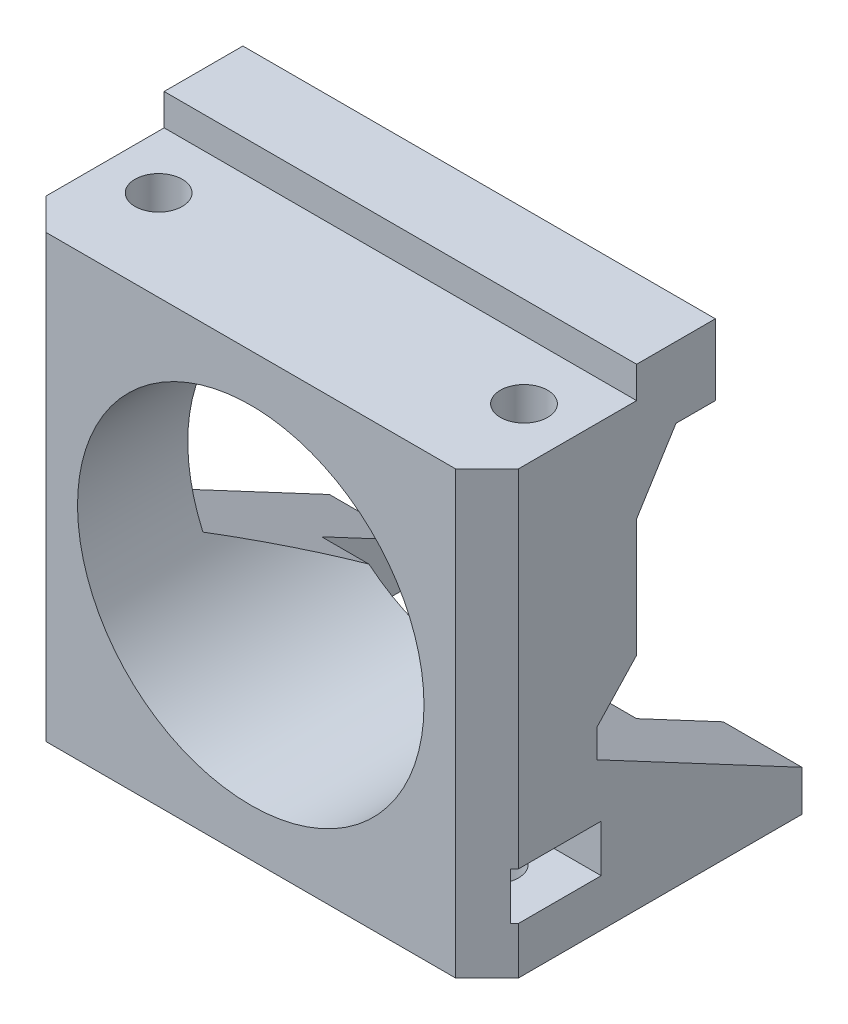
from build123d import *

# Parameters (mm, degrees)
SKETCH1_W                 = 30
SKETCH1_H                 = 28
SKETCH1_R                 = 11
BOSS_EXTRUDE1_DEPTH       = 7
SKETCH2_W                 = 5
SKETCH2_H                 = 2.5
BOSS_EXTRUDE2_DEPTH       = 13
CHAMFER2_SIZE             = 2
BOSS_EXTRUDE6_DEPTH       = 2.5
CHAMFER3_SIZE             = 2
CHAMFER4_SIZE             = 2
BOSS_EXTRUDE4_DEPTH       = 2.5
CHAMFER6_SIZE             = 2.5
CHAMFER7_SIZE             = 7
CHAMFER7_SIZE_2           = 13.165085257
SKETCH7_R                 = 1.5
CUT_EXTRUDE2_DEPTH        = 6.4
BOSS_EXTRUDE7_START       = -2.5
SKETCH8_W                 = 30
SKETCH8_H                 = 5
BOSS_EXTRUDE7_DEPTH       = 4.5
CHAMFER8_SIZE             = 4.000836323
CHAMFER8_SIZE_2           = 2.5
CUT_EXTRUDE3_START        = -3
SKETCH9_R                 = 1.5
CUT_EXTRUDE3_DEPTH        = 3
SKETCH10_W                = 5.5
SKETCH10_H                = 3
CUT_EXTRUDE4_DEPTH        = 5.6
CUT_EXTRUDE5_START        = -30
SKETCH10_2_W              = 5.5
SKETCH10_2_H              = 3
CUT_EXTRUDE5_DEPTH        = 5.6
F_1_0MM_DOWEL_HOLE1_D     = 3
F_1_0MM_DOWEL_HOLE1_DEPTH = 7.098709071
F_1_0MM_DOWEL_HOLE1_TIP   = 0.901290929


with BuildPart() as part:
    # Sketch1 → Boss-Extrude1 (new body)
    with BuildSketch(Plane.XY):
        Rectangle(SKETCH1_W, SKETCH1_H)
        Circle(SKETCH1_R, mode=Mode.SUBTRACT)
    extrude(amount=BOSS_EXTRUDE1_DEPTH)

    # Sketch2 → Boss-Extrude2 (add)
    with BuildSketch(Plane(origin=(0, 0, 0), x_dir=(-1, 0, 0), z_dir=(0, 0, -1))):
        with Locations((-12.5, -12.75)):
            Rectangle(SKETCH2_W, SKETCH2_H)
        with Locations((12.5, -12.75)):
            Rectangle(SKETCH2_W, SKETCH2_H)
    extrude(amount=BOSS_EXTRUDE2_DEPTH)

    # Chamfer2
    chamfer2_edges = [part.edges().sort_by_distance(p)[0] for p in [
        (-10, -12.75, 0),
        (10, -12.75, 0),
    ]]
    chamfer(chamfer2_edges, length=CHAMFER2_SIZE)

    # Sketch5 → Boss-Extrude6 (add)
    with BuildSketch(Plane.XZ.offset(14)):
        Polygon((-10, -2), (-10, -7.5), (10, -7.5), (10, -2), (8, 0), (-8, 0), align=None)
    extrude(amount=-BOSS_EXTRUDE6_DEPTH)

    # Chamfer3
    chamfer3_edges = [part.edges().sort_by_distance(p)[0] for p in [
        (15, 0, 7),
    ]]
    chamfer(chamfer3_edges, length=CHAMFER3_SIZE)

    # Chamfer4
    chamfer4_edges = [part.edges().sort_by_distance(p)[0] for p in [
        (-15, 0, 7),
    ]]
    chamfer(chamfer4_edges, length=CHAMFER4_SIZE)

    # Sketch4 → Boss-Extrude4 (add)
    with BuildSketch(Plane(origin=(0, 0, 0), x_dir=(-1, 0, 0), z_dir=(0, 0, -1))):
        Polygon((-15, 0), (15, 11.5), (15, 14), (-15, 14), align=None)
    extrude(amount=BOSS_EXTRUDE4_DEPTH)

    # Chamfer6
    # the kernel refuses this chamfer: 2.5 mm, written as the material it adds along each edge
    with BuildSketch(Plane(origin=(21.003247512, -2.30124488, 0), x_dir=(-0.3578006820796162, -0.9333930836859554, 0.02749587661058638), z_dir=(-0.9337461173020497, 0.35793601163245237, 0))) as chamfer6_piece_1_section:
        Polygon((CHAMFER6_SIZE * 0.999621916911, -CHAMFER6_SIZE * 0.0274958766106), (-CHAMFER6_SIZE * 0.0274958766106, -CHAMFER6_SIZE * 0.999621916911), (0, 0), align=None)
    chamfer6_piece_1 = extrude(amount=17.263908412, mode=Mode.PRIVATE)
    chamfer6_piece_1 = chamfer6_piece_1 - Plane(origin=(0, 0, -0.835393566), x_dir=(1, 0, 0), z_dir=(0, 0, -1)) * Cylinder(11, 45, mode=Mode.PRIVATE)
    chamfer6_piece_1 = split(chamfer6_piece_1, bisect_by=Plane(origin=(15, -0.113968884, -0.835393566), z_dir=(-1, 0, 0)), keep=Keep.TOP, mode=Mode.PRIVATE)
    add(chamfer6_piece_1)
    with BuildSketch(Plane(origin=(-1.03959441, 6.148511191, 0), x_dir=(-0.35780068207961624, -0.9333930836859554, 0.02749587661058638), z_dir=(-0.9337461173020497, 0.35793601163245237, 0))) as chamfer6_piece_2_section:
        Polygon((CHAMFER6_SIZE * 0.999621916911, -CHAMFER6_SIZE * 0.0274958766106), (-CHAMFER6_SIZE * 0.0274958766106, -CHAMFER6_SIZE * 0.999621916911), (0, 0), align=None)
    chamfer6_piece_2 = extrude(amount=21.380172546, mode=Mode.PRIVATE)
    chamfer6_piece_2 = chamfer6_piece_2 - Plane(origin=(0, 0, -0.851534645), x_dir=(1, 0, 0), z_dir=(0, 0, -1)) * Cylinder(11, 53, mode=Mode.PRIVATE)
    chamfer6_piece_2 = split(chamfer6_piece_2, bisect_by=Plane(origin=(-15, 9.244820467, -0.851534645), z_dir=(1, 0, 0)), keep=Keep.TOP, mode=Mode.PRIVATE)
    add(chamfer6_piece_2)

    # Chamfer7
    # the kernel refuses this chamfer: 13.165085257, 7 mm, written as the material it adds along each edge
    with BuildSketch(Plane(origin=(-15, -11.5, 0), x_dir=(0, 0.9979482451756082, 0.06402577567608186), z_dir=(1, 0, 0))) as chamfer7_piece_1_section:
        Polygon((CHAMFER7_SIZE * 0.997948245176, -CHAMFER7_SIZE * 0.0640257756761), (-CHAMFER7_SIZE_2 * 0.0640257756781, -CHAMFER7_SIZE_2 * 0.997948245208), (0, 0), align=None)
    chamfer7_piece_1 = extrude(amount=30, mode=Mode.PRIVATE)
    chamfer7_piece_1 = chamfer7_piece_1 - Plane(origin=(0, 0, -3.073682767), x_dir=(1, 0, 0), z_dir=(0, 0, -1)) * Cylinder(11, 113, mode=Mode.PRIVATE)
    chamfer7_piece_1 = split(chamfer7_piece_1, bisect_by=Plane(origin=(-10, -8.887755394, -3.073682767), z_dir=(-1, 0, 0)), keep=Keep.TOP, mode=Mode.PRIVATE)
    chamfer7_piece_1 = split(chamfer7_piece_1, bisect_by=Plane(origin=(-12.500128058, -8.887755394, -7.5), z_dir=(0, 0, 1)), keep=Keep.TOP, mode=Mode.PRIVATE)
    add(chamfer7_piece_1)
    with BuildSketch(Plane(origin=(-15, -11.5, 0), x_dir=(0, 0.9979482451756082, 0.06402577567608186), z_dir=(1, 0, 0))) as chamfer7_piece_2_section:
        Polygon((CHAMFER7_SIZE * 0.997948245176, -CHAMFER7_SIZE * 0.0640257756761), (-CHAMFER7_SIZE_2 * 0.0640257756781, -CHAMFER7_SIZE_2 * 0.997948245208), (0, 0), align=None)
    chamfer7_piece_2 = extrude(amount=30, mode=Mode.PRIVATE)
    chamfer7_piece_2 = split(chamfer7_piece_2, bisect_by=Plane(origin=(-10, -10.721530873, -9.597564575), z_dir=(-1, 0, 0)), keep=Keep.TOP, mode=Mode.PRIVATE)
    chamfer7_piece_2 = split(chamfer7_piece_2, bisect_by=Plane(origin=(-12.5, -10.721530873, -7.5), z_dir=(0, 0, -1)), keep=Keep.TOP, mode=Mode.PRIVATE)
    chamfer7_piece_2 = split(chamfer7_piece_2, bisect_by=Plane(origin=(-12.5, -10.721530873, -13), z_dir=(0, 0, 1)), keep=Keep.TOP, mode=Mode.PRIVATE)
    add(chamfer7_piece_2)
    with BuildSketch(Plane(origin=(-15, -11.5, 0), x_dir=(0, 0.9979482451756082, 0.06402577567608186), z_dir=(1, 0, 0))) as chamfer7_piece_3_section:
        Polygon((CHAMFER7_SIZE * 0.997948245176, -CHAMFER7_SIZE * 0.0640257756761), (-CHAMFER7_SIZE_2 * 0.0640257756781, -CHAMFER7_SIZE_2 * 0.997948245208), (0, 0), align=None)
    chamfer7_piece_3 = extrude(amount=30, mode=Mode.PRIVATE)
    chamfer7_piece_3 = chamfer7_piece_3 - Plane(origin=(0, 0, -3.793876077), x_dir=(1, 0, 0), z_dir=(0, 0, -1)) * Cylinder(11, 113, mode=Mode.PRIVATE)
    chamfer7_piece_3 = split(chamfer7_piece_3, bisect_by=Plane(origin=(-10, -6.598719884, -3.793876077), z_dir=(1, 0, 0)), keep=Keep.TOP, mode=Mode.PRIVATE)
    chamfer7_piece_3 = split(chamfer7_piece_3, bisect_by=Plane(origin=(-9.499486782, -6.598719884, -7.5), z_dir=(0, 0, 1)), keep=Keep.TOP, mode=Mode.PRIVATE)
    chamfer7_piece_3 = split(chamfer7_piece_3, bisect_by=Plane(origin=(10, -6.598719884, -3.793876077), z_dir=(-1, 0, 0)), keep=Keep.TOP, mode=Mode.PRIVATE)
    add(chamfer7_piece_3)
    with BuildSketch(Plane(origin=(-15, -11.5, 0), x_dir=(0, 0.9979482451756082, 0.06402577567608186), z_dir=(1, 0, 0))) as chamfer7_piece_4_section:
        Polygon((CHAMFER7_SIZE * 0.997948245176, -CHAMFER7_SIZE * 0.0640257756761), (-CHAMFER7_SIZE_2 * 0.0640257756781, -CHAMFER7_SIZE_2 * 0.997948245208), (0, 0), align=None)
    chamfer7_piece_4 = extrude(amount=30, mode=Mode.PRIVATE)
    chamfer7_piece_4 = split(chamfer7_piece_4, bisect_by=Plane(origin=(12.5, -10.721530873, -7.5), z_dir=(0, 0, -1)), keep=Keep.TOP, mode=Mode.PRIVATE)
    chamfer7_piece_4 = split(chamfer7_piece_4, bisect_by=Plane(origin=(10, -10.721530873, -9.597564575), z_dir=(1, 0, 0)), keep=Keep.TOP, mode=Mode.PRIVATE)
    chamfer7_piece_4 = split(chamfer7_piece_4, bisect_by=Plane(origin=(12.5, -10.721530873, -13), z_dir=(0, 0, 1)), keep=Keep.TOP, mode=Mode.PRIVATE)
    add(chamfer7_piece_4)
    with BuildSketch(Plane(origin=(-15, -11.5, 0), x_dir=(0, 0.9979482451756082, 0.06402577567608186), z_dir=(1, 0, 0))) as chamfer7_piece_5_section:
        Polygon((CHAMFER7_SIZE * 0.997948245176, -CHAMFER7_SIZE * 0.0640257756761), (-CHAMFER7_SIZE_2 * 0.0640257756781, -CHAMFER7_SIZE_2 * 0.997948245208), (0, 0), align=None)
    chamfer7_piece_5 = extrude(amount=30, mode=Mode.PRIVATE)
    chamfer7_piece_5 = chamfer7_piece_5 - Plane(origin=(0, 0, -3.073682766), x_dir=(1, 0, 0), z_dir=(0, 0, -1)) * Cylinder(11, 113, mode=Mode.PRIVATE)
    chamfer7_piece_5 = split(chamfer7_piece_5, bisect_by=Plane(origin=(12.500128057, -8.887755394, -7.5), z_dir=(0, 0, 1)), keep=Keep.TOP, mode=Mode.PRIVATE)
    chamfer7_piece_5 = split(chamfer7_piece_5, bisect_by=Plane(origin=(10, -8.887755394, -3.073682766), z_dir=(1, 0, 0)), keep=Keep.TOP, mode=Mode.PRIVATE)
    add(chamfer7_piece_5)

    # Sketch7 → Cut-Extrude2 (cut)
    with BuildSketch(Plane.XZ.offset(14)):
        with Locations(Location((-11, 2.5, 0), (0, 0, 270))):
            Circle(SKETCH7_R)
        with Locations(Location((11, 2.5, 0), (0, 0, 270))):
            Circle(SKETCH7_R)
    extrude(amount=-CUT_EXTRUDE2_DEPTH, mode=Mode.SUBTRACT)

    # Sketch8 → Boss-Extrude7 (add)
    with BuildSketch(Plane(origin=(0, 14, 0), x_dir=(1, 0, 0), z_dir=(0, 1, 0)).offset(BOSS_EXTRUDE7_START)):
        with Locations((0, 5)):
            Rectangle(SKETCH8_W, SKETCH8_H)
    extrude(amount=BOSS_EXTRUDE7_DEPTH)

    # Chamfer8
    # the kernel refuses this chamfer: 4.000836323, 2.5 mm, written as the material it adds along each edge
    with BuildSketch(Plane(origin=(-25.343554005, 11.5, -2.5), x_dir=(0, -0.9997899140358645, 0.02049701910421793), z_dir=(1, 0, 0))) as chamfer8_piece_1_section:
        Polygon((CHAMFER8_SIZE * 0.999789913937, CHAMFER8_SIZE * 0.0204970191022), (-CHAMFER8_SIZE_2 * 0.0204970191042, CHAMFER8_SIZE_2 * 0.999789914036), (0, 0), align=None)
    chamfer8_piece_1 = extrude(amount=40.343554005, mode=Mode.PRIVATE)
    chamfer8_piece_1 = split(chamfer8_piece_1, bisect_by=Plane(origin=(2.975759377, 8.202968449, -5.855581208), z_dir=(0.25309898105600476, 0.6602582114512465, 0.707106781186274)), keep=Keep.TOP, mode=Mode.PRIVATE)
    add(chamfer8_piece_1)

    # Sketch9 → Cut-Extrude3 (cut)
    # profile 1 of 2: a face of its own
    with BuildSketch(Plane.XZ.offset(14).offset(CUT_EXTRUDE3_START)):
        Polygon((7.824573519, 2.5), (9.41228676, -0.25), (12.58771324, -0.25), (14.175426481, 2.5), (12.58771324, 5.25), (9.41228676, 5.25), align=None)
        with Locations(Location((11, 2.5, 0), (0, 0, 270))):
            Circle(SKETCH9_R, mode=Mode.SUBTRACT)
    # profile 2 of 2: a face of its own
    with BuildSketch(Plane.XZ.offset(14).offset(CUT_EXTRUDE3_START)):
        Polygon((-7.824573519, 2.5), (-9.41228676, 5.25), (-12.58771324, 5.25), (-14.175426481, 2.5), (-12.58771324, -0.25), (-9.41228676, -0.25), align=None)
        with Locations(Location((-11, 2.5, 0), (0, 0, 270))):
            Circle(SKETCH9_R, mode=Mode.SUBTRACT)
    extrude(amount=-CUT_EXTRUDE3_DEPTH, mode=Mode.SUBTRACT)

    # Sketch10 → Cut-Extrude4 (cut)
    with BuildSketch(Plane(origin=(15, 0, 0), x_dir=(0, 0, -1), z_dir=(1, 0, 0))):
        with Locations((-2.5, -9.5)):
            Rectangle(SKETCH10_W, SKETCH10_H)
    extrude(amount=-CUT_EXTRUDE4_DEPTH, mode=Mode.SUBTRACT)

    # Sketch10<2> → Cut-Extrude5 (cut)
    with BuildSketch(Plane(origin=(15, 0, 0), x_dir=(0, 0, -1), z_dir=(1, 0, 0)).offset(CUT_EXTRUDE5_START)):
        with Locations((-2.5, -9.5)):
            Rectangle(SKETCH10_2_W, SKETCH10_2_H)
    extrude(amount=CUT_EXTRUDE5_DEPTH, mode=Mode.SUBTRACT)

    # Ø1.0mm Dowel Hole1
    with Locations(Plane(origin=(0, 14, 0), x_dir=(1, 0, 0), z_dir=(0, 1, 0))):
        with Locations((-11.6, -1.25), (11.6, -1.25)):
            Hole(F_1_0MM_DOWEL_HOLE1_D / 2, depth=F_1_0MM_DOWEL_HOLE1_DEPTH)
            with Locations((0, 0, -(F_1_0MM_DOWEL_HOLE1_DEPTH + F_1_0MM_DOWEL_HOLE1_TIP / 2))):  # 118° drill point
                Cone(0, F_1_0MM_DOWEL_HOLE1_D / 2, F_1_0MM_DOWEL_HOLE1_TIP, mode=Mode.SUBTRACT)


solid = part.part
